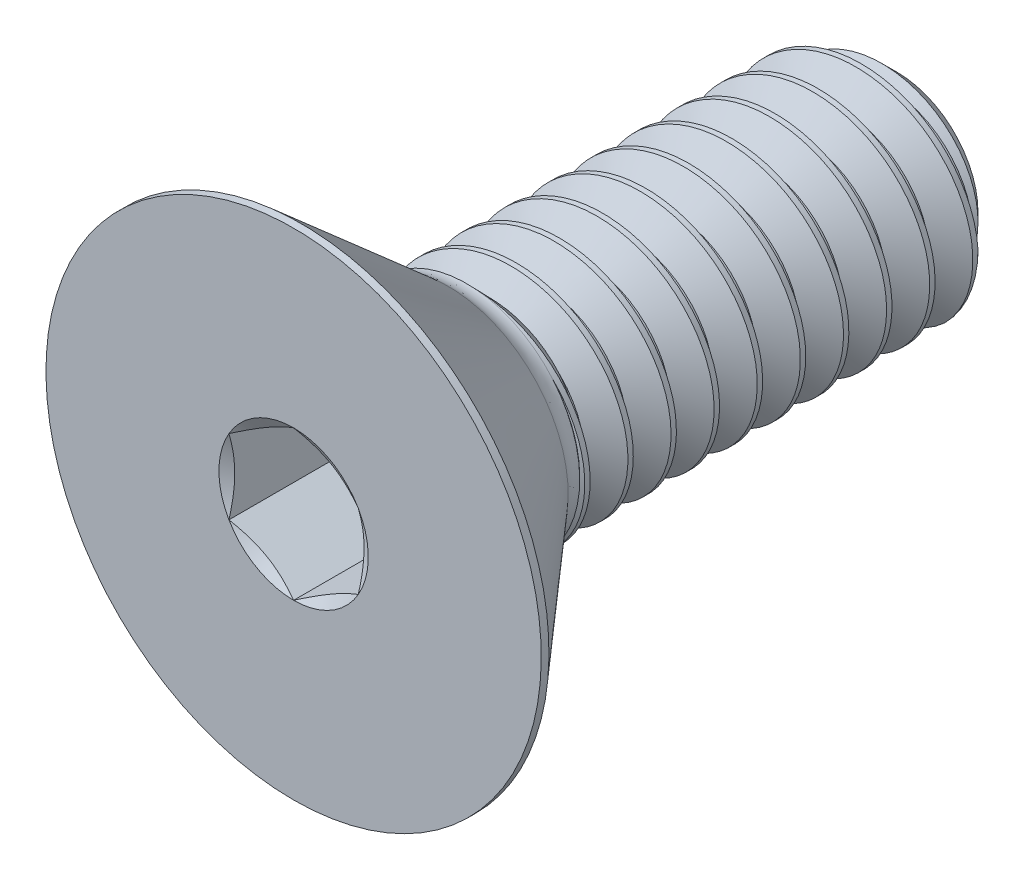
from build123d import *
from build123d.topology import SkipClean

# Parameters (mm, degrees)
SKETCH1_W          = 11.1125
SKETCH1_H          = 2.0828
CHAMFER1_SIZE      = 0.5953125
CUT_SWEEP1_PITCH   = 0.79375
CUT_EXTRUDE2_DEPTH = 1.99136


with BuildPart() as part:
    # Sketch1 → Revolve1 (revolve)
    with BuildSketch(Plane(origin=(0, 0, 0), x_dir=(0, 0, -1), z_dir=(1, 0, 0)), mode=Mode.PRIVATE) as revolve1_sk:
        with Locations((5.55625, 1.0414)):
            Rectangle(SKETCH1_W, SKETCH1_H)
    revolve(revolve1_sk.sketch.rotate(Axis((0, 0, -11.1125), (0, 0, 1)), 90), axis=Axis((0, 0, -11.1125), (0, 0, 1)))

    # Chamfer1
    chamfer1_edges = [part.edges().sort_by_distance(p)[0] for p in [
        (2.0828, 0, -11.1125),
    ]]
    chamfer(chamfer1_edges, length=CHAMFER1_SIZE)

    # Cut-Sweep1: the profile of Sketch2 profile screwed along a right-hand helix of 14 turns, 8 arcs to a turn; built about Z, then put on its axis
    with SkipClean():  # the faces are left unmerged after this step: merging them gives an invalid solid
        cut_sweep1_z = Axis((0, 0, 0), (0, 0, 1))
        cut_sweep1_corners = [(2.0831, 0, 0.000173205), (2.0831, 0, -0.694704455), (1.567244252, 0, -0.396875), (1.567244252, 0, -0.29765625)]
        with BuildLine(mode=Mode.PRIVATE) as cut_sweep1_profile:
            Line(cut_sweep1_corners[0], cut_sweep1_corners[1])
            Line(cut_sweep1_corners[1], cut_sweep1_corners[2])
            Line(cut_sweep1_corners[2], cut_sweep1_corners[3])
            Line(cut_sweep1_corners[3], cut_sweep1_corners[0])
        cut_sweep1_cap = Face(cut_sweep1_profile.wire())
        cut_sweep1_turn_angles = [0, 22.5, 45, 67.5, 90, 112.5, 135, 157.5, 180, 202.5, 225, 247.5, 270, 292.5, 315, 337.5, 360]
        cut_sweep1_turn_weights = [1, 0.9238795325112867, 1, 0.9238795325112867, 1, 0.9238795325112867, 1, 0.9238795325112867, 1, 0.9238795325112867, 1, 0.9238795325112867, 1, 0.9238795325112867, 1, 0.9238795325112867, 1]
        cut_sweep1_turn_rails = [Edge.make_bspline([Vector(p[0], p[1], 0).rotate(cut_sweep1_z, cut_sweep1_turn_angles[k]) / cut_sweep1_turn_weights[k] + Vector(0, 0, p[2] + CUT_SWEEP1_PITCH * cut_sweep1_turn_angles[k] / 360) for k in range(17)], [0, 0, 0, 1, 1, 2, 2, 3, 3, 4, 4, 5, 5, 6, 6, 7, 7, 8, 8, 8], 2, cut_sweep1_turn_weights) for p in cut_sweep1_corners]
        cut_sweep1_turn_sides = [Face.make_surface_from_curves(cut_sweep1_turn_rails[p[0]], cut_sweep1_turn_rails[p[1]]) for p in [(0, 1), (1, 2), (2, 3), (3, 0)]]
        cut_sweep1 = Plane(origin=(0, 0, -11.1125), x_dir=(0, 1, 0), z_dir=(0, 0, 1)) * Solid(Shell([*[p.moved(Location((0, 0, CUT_SWEEP1_PITCH * i))) for i in range(14) for p in cut_sweep1_turn_sides], cut_sweep1_cap, cut_sweep1_cap.rotate(cut_sweep1_z, 5040).moved(Location((0, 0, CUT_SWEEP1_PITCH * 5040 / 360)))]))
        add(cut_sweep1, mode=Mode.SUBTRACT)

    # Sketch7 → Revolve2 (revolve)
    with BuildSketch(Plane(origin=(0, 0, 0), x_dir=(0, 0, -1), z_dir=(1, 0, 0)), mode=Mode.PRIVATE) as revolve2_sk:
        with BuildLine():
            Line((0, 4.5593), (0.14224, 4.5593))
            Line((0.14224, 4.5593), (2.8448, 2.210000434))
            ThreePointArc((2.8448, 2.210000434), (3.003405714, 2.11563995), (3.185013014, 2.0828))
            Line((3.185013014, 2.0828), (3.185013014, 0))
            Line((3.185013014, 0), (0, 0))
            Line((0, 0), (0, 4.5593))
        make_face()
    revolve(revolve2_sk.sketch.rotate(Axis((0, 0, 0), (0, 0, -1)), 180), axis=Axis((0, 0, 0), (0, 0, -1)))

    # Boss-Extrude1 cone 1 section (through the dimple's axis) → Boss-Extrude1 (revolve)
    with BuildSketch(Plane(origin=(0, 0, -3.185013014), x_dir=(0, -1, 0), z_dir=(1, 0, 0))):
        Polygon((0, 0), (2.0828, 0), (0, 2.01133658), align=None)
    revolve(axis=Axis((0, 0, -3.185013014), (0, 0, -1)))

    # Sketch5 → Cut-Extrude2 (cut)
    with BuildSketch(Plane.XY):
        Polygon((0, 1.374815329), (-1.190625, 0.687407664), (-1.190625, -0.687407664), (0, -1.374815329), (1.190625, -0.687407664), (1.190625, 0.687407664), align=None)
    extrude(amount=-CUT_EXTRUDE2_DEPTH, mode=Mode.SUBTRACT)

    # Cut-Extrude3 cone 1 section (through the dimple's axis) → Cut-Extrude3 (revolve, cut)
    with BuildSketch(Plane(origin=(0, 0, 0), x_dir=(0, -1, 0), z_dir=(1, 0, 0))):
        Polygon((0, 0), (1.374815329, 0), (0, 0.79375), align=None)
    revolve(axis=Axis((0, 0, 0), (0, 0, -1)), mode=Mode.SUBTRACT)


solid = part.part
